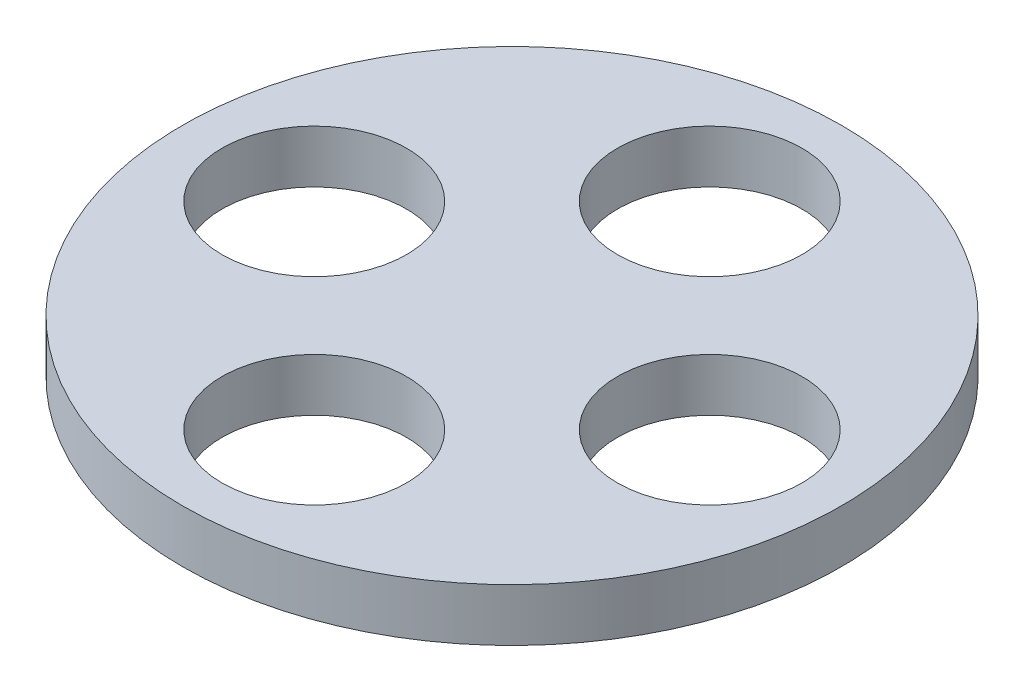
from build123d import *

# Parameters (mm, degrees)
SKETCH1_R           = 125
BOSS_EXTRUDE1_DEPTH = 20
SKETCH2_R           = 35
CUT_EXTRUDE1_DEPTH  = 178.904468747


with BuildPart() as part:
    # Sketch1 → Boss-Extrude1 (new body)
    with BuildSketch(Plane(origin=(0, 0, 0), x_dir=(1, 0, 0), z_dir=(0, 1, 0))):
        Circle(SKETCH1_R)
    extrude(amount=BOSS_EXTRUDE1_DEPTH)

    # Sketch2 → Cut-Extrude1 (cut, through all)
    with BuildSketch(Plane(origin=(0, 20, 0), x_dir=(1, 0, 0), z_dir=(0, 1, 0))):
        with Locations((0, 75)):
            Circle(SKETCH2_R)
        with Locations((75, 0)):
            Circle(SKETCH2_R)
        with Locations((0, -75)):
            Circle(SKETCH2_R)
        with Locations((-75, 0)):
            Circle(SKETCH2_R)
    extrude(amount=-CUT_EXTRUDE1_DEPTH, mode=Mode.SUBTRACT)


solid = part.part
